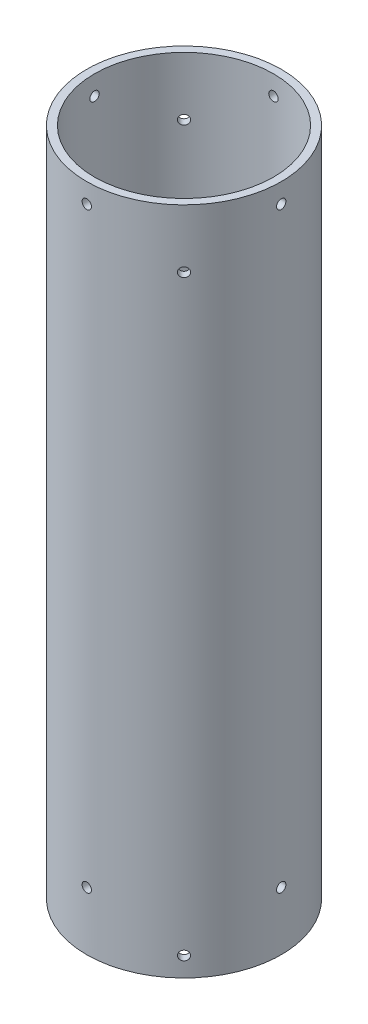
from build123d import *

# Parameters (mm, degrees)
SKETCH_1_R               = 25
SKETCH_1_R_2             = 23
EXTRUDE_1_DEPTH          = 172
SKETCH_3_R               = 1.2
CUT_EXTRUDE_2_DEPTH      = 176.59612752
PATTERN_CIRCULAR_1_COUNT = 4
SKETCH_11_R              = 1.2
CUT_EXTRUDE_10_DEPTH     = 176.596127648
PATTERN_CIRCULAR_2_COUNT = 4


with BuildPart() as part:
    # Эскиз1 → Бобышка-Вытянуть1 (new body)
    with BuildSketch(Plane(origin=(0, 0, 0), x_dir=(1, 0, 0), z_dir=(0, 1, 0))):
        Circle(SKETCH_1_R)
        Circle(SKETCH_1_R_2, mode=Mode.SUBTRACT)
    extrude(amount=EXTRUDE_1_DEPTH)

    # Эскиз3 → Вырез-Вытянуть2 (cut, through all)
    with BuildSketch(Plane(origin=(0, 0, 0), x_dir=(0, 0, -1), z_dir=(1, 0, 0))):
        with Locations((0, 167)):
            Circle(SKETCH_3_R)
        with Locations((0, 15)):
            Circle(SKETCH_3_R)
    cut_extrude_2 = extrude(amount=-CUT_EXTRUDE_2_DEPTH, mode=Mode.SUBTRACT)

    # Круговой массив1: Вырез-Вытянуть2 ×4 about axis
    pattern_circular_1_axis = Axis((0, 172, 0), (0, -1, 0))
    for i in range(1, PATTERN_CIRCULAR_1_COUNT):
        add(cut_extrude_2.rotate(pattern_circular_1_axis, i * 360 / PATTERN_CIRCULAR_1_COUNT), mode=Mode.SUBTRACT)

    # Эскиз11 → Вырез-Вытянуть10 (cut, through all)
    with BuildSketch(Plane(origin=(0, 0, 0), x_dir=(0, -1, 0), z_dir=(-0.7071067811865488, 0, 0.7071067811865464))):
        with Locations((-5, 0)):
            Circle(SKETCH_11_R)
        with Locations((-157, 0)):
            Circle(SKETCH_11_R)
    cut_extrude_10 = extrude(amount=-CUT_EXTRUDE_10_DEPTH, mode=Mode.SUBTRACT)

    # Круговой массив2: Вырез-Вытянуть10 ×4 about axis
    pattern_circular_2_axis = Axis((0, 172, 0), (0, -1, 0))
    for i in range(1, PATTERN_CIRCULAR_2_COUNT):
        add(cut_extrude_10.rotate(pattern_circular_2_axis, i * 360 / PATTERN_CIRCULAR_2_COUNT), mode=Mode.SUBTRACT)


solid = part.part
